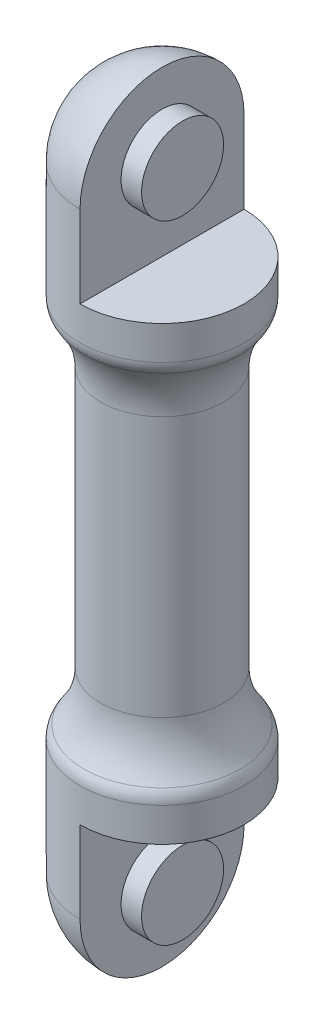
from build123d import *

# Parameters (mm, degrees)
SKETCH1_R           = 40
BOSS_EXTRUDE1_DEPTH = 100
SKETCH3_R           = 30
BOSS_EXTRUDE2_DEPTH = 180
SKETCH4_R           = 40
BOSS_EXTRUDE3_DEPTH = 100
SKETCH5_W           = 41.242816752
SKETCH5_H           = 81.516639277
CUT_EXTRUDE1_DEPTH  = 80
SKETCH6_W           = 41.962077935
SKETCH6_H           = 81.514478353
CUT_EXTRUDE2_DEPTH  = 80
FILLET3_R           = 40
FILLET4_R           = 40
SKETCH7_R           = 20
BOSS_EXTRUDE4_DEPTH = 10
SKETCH8_R           = 20
BOSS_EXTRUDE5_DEPTH = 10
FILLET5_R           = 40
FILLET6_R           = 40
FILLET7_R           = 10
FILLET8_R           = 10


# Some blends are built 0.0001 mm under size
with BuildPart() as part:
    # Sketch1 → Boss-Extrude1 (new body)
    with BuildSketch(Plane(origin=(0, 0, 0), x_dir=(1, 0, 0), z_dir=(0, 1, 0))):
        with Locations(Location((0, 0, 0), (0, 0, 270))):
            Circle(SKETCH1_R)
    extrude(amount=BOSS_EXTRUDE1_DEPTH)

    # Sketch3 → Boss-Extrude2 (add)
    with BuildSketch(Plane(origin=(0, 100, 0), x_dir=(1, 0, 0), z_dir=(0, 1, 0))):
        with Locations(Location((0, 0, 0), (0, 0, 90))):
            Circle(SKETCH3_R)
    extrude(amount=BOSS_EXTRUDE2_DEPTH)

    # Sketch4 → Boss-Extrude3 (add)
    with BuildSketch(Plane(origin=(0, 280, 0), x_dir=(1, 0, 0), z_dir=(0, 1, 0))):
        with Locations(Location((0, 0, 0), (0, 0, 270))):
            Circle(SKETCH4_R)
    extrude(amount=BOSS_EXTRUDE3_DEPTH)

    # Sketch5 → Cut-Extrude1 (cut)
    with BuildSketch(Plane(origin=(0, 380, 0), x_dir=(1, 0, 0), z_dir=(0, 1, 0))):
        with Locations((20.621408376, 0.242248556)):
            Rectangle(SKETCH5_W, SKETCH5_H)
    extrude(amount=-CUT_EXTRUDE1_DEPTH, mode=Mode.SUBTRACT)

    # Sketch6 → Cut-Extrude2 (cut)
    with BuildSketch(Plane.XZ):
        with Locations((20.981038968, -0.067313451)):
            Rectangle(SKETCH6_W, SKETCH6_H)
    extrude(amount=-CUT_EXTRUDE2_DEPTH, mode=Mode.SUBTRACT)

    # Fillet3
    fillet3_edges = [part.edges().sort_by_distance(p)[0] for p in [
        (-40, 0, 0),
    ]]
    fillet(fillet3_edges, radius=FILLET3_R - 0.0001)  # a hair under: the kernel refuses the full size

    # Fillet4
    fillet4_edges = [part.edges().sort_by_distance(p)[0] for p in [
        (-40, 380, 0),
    ]]
    fillet(fillet4_edges, radius=FILLET4_R - 0.0001)  # a hair under: the kernel refuses the full size

    # Sketch7 → Boss-Extrude4 (add)
    with BuildSketch(Plane(origin=(0, 0, 0), x_dir=(0, 0, -1), z_dir=(1, 0, 0))):
        with Locations(Location((0, 36.360995044, 0), (0, 0, 180))):
            Circle(SKETCH7_R)
    extrude(amount=BOSS_EXTRUDE4_DEPTH)

    # Sketch8 → Boss-Extrude5 (add)
    with BuildSketch(Plane(origin=(0, 0, 0), x_dir=(0, 0, -1), z_dir=(1, 0, 0))):
        with Locations(Location((0, 342.283138074, 0), (0, 0, 180))):
            Circle(SKETCH8_R)
    extrude(amount=BOSS_EXTRUDE5_DEPTH)

    # Fillet5
    # the kernel refuses this fillet: 40 mm, written as the material it adds along each edge
    with BuildSketch(Plane(origin=(0, 100, 0), x_dir=(0, 0, -1), z_dir=(1, 0, 0))) as fillet5_piece_1:
        with BuildLine():
            CenterArc((70, 26.457513111), FILLET5_R, 180, 41.409622109)
            Line((40, 0), (39.4, -0.529150262))
            ThreePointArc((39.4, -0.529150262), (35, -0.8), (30, -0.8))
            Line((30, -0.8), (29.2, 0))
            Line((29.2, 0), (29.2, 26.457513111))
            Line((29.2, 26.457513111), (30, 26.457513111))
        make_face()
    revolve(axis=Axis((0, 100, 0), (0, 1, 0)))

    # Fillet6
    # the kernel refuses this fillet: 40 mm, written as the material it adds along each edge
    with BuildSketch(Plane(origin=(0, 280, 0), x_dir=(0, 0, -1), z_dir=(1, 0, 0))) as fillet6_piece_1:
        with BuildLine():
            CenterArc((70, -26.457513111), FILLET6_R, 138.590377891, 41.409622109)
            Line((40, 0), (39.4, 0.529150262))
            ThreePointArc((39.4, 0.529150262), (35, 0.8), (30, 0.8))
            Line((30, 0.8), (29.2, 0))
            Line((29.2, 0), (29.2, -26.457513111))
            Line((29.2, -26.457513111), (30, -26.457513111))
        make_face()
    revolve(axis=Axis((0, 280, 0), (0, 1, 0)))

    # Fillet7
    fillet7_edges = [part.edges().sort_by_distance(p)[0] for p in [
        (40, 280, 0),
    ]]
    fillet(fillet7_edges, radius=FILLET7_R)

    # Fillet8
    fillet8_edges = [part.edges().sort_by_distance(p)[0] for p in [
        (-40, 100, 0),
    ]]
    fillet(fillet8_edges, radius=FILLET8_R)


solid = part.part
